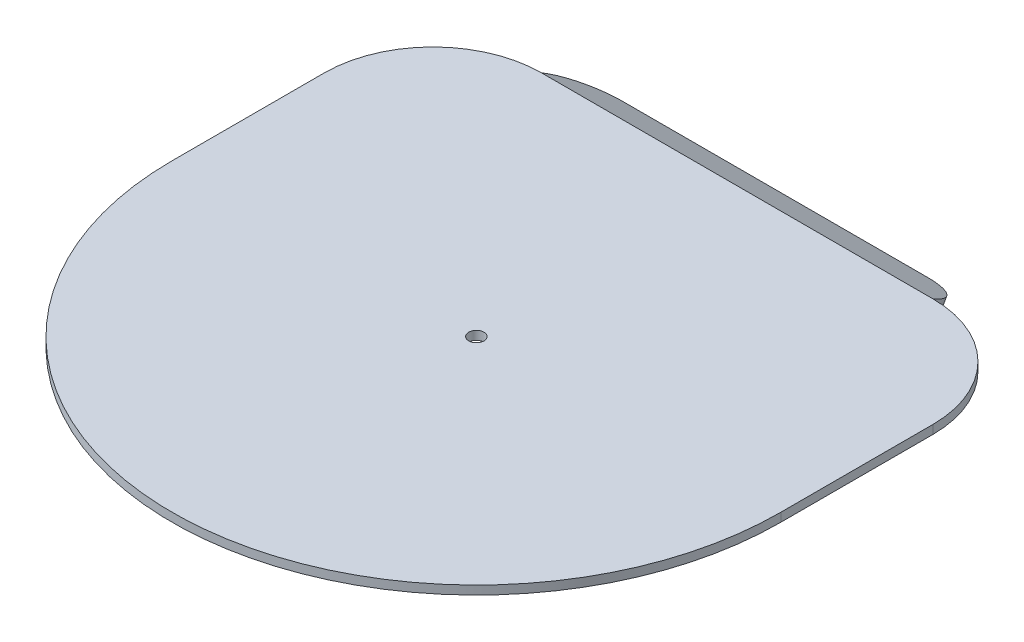
from build123d import *

# Parameters (mm, degrees)
BOSS_EXTRUDE1_DEPTH      = 2
BOSS_EXTRUDE2_DEPTH      = 45
BOSS_EXTRUDE2_DEPTH_BACK = 45
FILLET1_R                = 10
SKETCH4_R                = 1.75
CUT_EXTRUDE2_DEPTH       = 10
SKETCH5_R                = 37
SKETCH5_R_2              = 35
BOSS_EXTRUDE3_DEPTH      = 5
SKETCH6_R                = 43
SKETCH6_R_2              = 41
BOSS_EXTRUDE4_DEPTH      = 5
SKETCH7_W                = 8
SKETCH7_H                = 7.537403722
BOSS_EXTRUDE5_DEPTH      = 5
SKETCH8_R                = 2
CUT_EXTRUDE3_DEPTH       = 25
CIRPATTERN1_COUNT        = 8


with BuildPart() as part:
    # Sketch1 → Boss-Extrude1 (new body)
    with BuildSketch(Plane(origin=(0, 0, 0), x_dir=(1, 0, 0), z_dir=(0, 1, 0))):
        with BuildLine():
            Line((-70, 0), (-70, 35))
            ThreePointArc((-70, 35), (-62.67766953, 52.67766953), (-45, 60))
            Line((-45, 60), (45, 60))
            ThreePointArc((45, 60), (62.67766953, 52.67766953), (70, 35))
            Line((70, 35), (70, 0))
            ThreePointArc((70, 0), (0, -70), (-70, 0))
        make_face()
    extrude(amount=BOSS_EXTRUDE1_DEPTH)

    # Sketch3 → Boss-Extrude2 (add, two sides: drawn at the far end of the back side and taken through both)
    with BuildSketch(Plane(origin=(0, 0, 0), x_dir=(0, 0, -1), z_dir=(1, 0, 0)).offset(-BOSS_EXTRUDE2_DEPTH_BACK)):
        Polygon((60, 2), (58.845299462, 0), (67.505553499, -5), (68.660254038, -3), align=None)
    extrude(amount=BOSS_EXTRUDE2_DEPTH + BOSS_EXTRUDE2_DEPTH_BACK)

    # Fillet1
    # the kernel refuses this fillet: 10 mm, written as the material it takes off along each edge
    with BuildSketch(Plane(origin=(-45, -26.650635095, -55.005553499), x_dir=(0, 0.4999999999999941, 0.866025403784442), z_dir=(0, 0.866025403784442, -0.49999999999999417))) as fillet1_piece_1_section:
        with BuildLine():
            CenterArc((FILLET1_R, FILLET1_R), FILLET1_R, 180, 90)
            Line((0, FILLET1_R), (0, 0))
            Line((0, 0), (FILLET1_R, 0))
        make_face()
    fillet1_piece_1 = extrude(amount=52.309401077, mode=Mode.PRIVATE)
    fillet1_piece_1 = fillet1_piece_1 & Plane(origin=(-45, -18.824797401, -35), x_dir=(-1, 0, 0), z_dir=(0, -1, 0)) * Cylinder(25, 145, mode=Mode.PRIVATE)
    fillet1_piece_1 = split(fillet1_piece_1, bisect_by=Plane(origin=(-43.184486193, 0, -56.170911552), z_dir=(0, -1, 0)), keep=Keep.TOP, mode=Mode.PRIVATE)
    add(fillet1_piece_1, mode=Mode.SUBTRACT)
    with BuildSketch(Plane(origin=(-45, -26.650635095, -55.005553499), x_dir=(0, 0.4999999999999941, 0.866025403784442), z_dir=(0, 0.866025403784442, -0.49999999999999417))) as fillet1_piece_2_section:
        with BuildLine():
            CenterArc((FILLET1_R, FILLET1_R), FILLET1_R, 180, 90)
            Line((0, FILLET1_R), (0, 0))
            Line((0, 0), (FILLET1_R, 0))
        make_face()
    fillet1_piece_2 = extrude(amount=52.309401077, mode=Mode.PRIVATE)
    fillet1_piece_2 = fillet1_piece_2 - Plane(origin=(-45, -7.670115749, -35), x_dir=(-1, 0, 0), z_dir=(0, -1, 0)) * Cylinder(25, 145, mode=Mode.PRIVATE)
    fillet1_piece_2 = split(fillet1_piece_2, bisect_by=Plane(origin=(-42.257371848, 0, -64.168812887), z_dir=(0, -1, 0)), keep=Keep.TOP, mode=Mode.PRIVATE)
    add(fillet1_piece_2, mode=Mode.SUBTRACT)
    with BuildSketch(Plane(origin=(-45, -26.650635095, -55.005553499), x_dir=(0, 0.4999999999999941, 0.866025403784442), z_dir=(0, 0.866025403784442, -0.49999999999999417))) as fillet1_piece_3_section:
        with BuildLine():
            CenterArc((FILLET1_R, FILLET1_R), FILLET1_R, 180, 90)
            Line((0, FILLET1_R), (0, 0))
            Line((0, 0), (FILLET1_R, 0))
        make_face()
    fillet1_piece_3 = extrude(amount=52.309401077, mode=Mode.PRIVATE)
    fillet1_piece_3 = fillet1_piece_3 - Plane(origin=(-45, 9.924498684, -35), x_dir=(-1, 0, 0), z_dir=(0, -1, 0)) * Cylinder(25, 145, mode=Mode.PRIVATE)
    fillet1_piece_3 = split(fillet1_piece_3, bisect_by=Plane(origin=(-42.804499142, 0, -73.375859485), z_dir=(0, 1, 0)), keep=Keep.TOP, mode=Mode.PRIVATE)
    add(fillet1_piece_3, mode=Mode.SUBTRACT)
    with BuildSketch(Plane(origin=(45, -26.650635095, -55.005553499), x_dir=(0, 0.4999999999999941, 0.866025403784442), z_dir=(0, 0.866025403784442, -0.49999999999999417))) as fillet1_piece_4_section:
        with BuildLine():
            CenterArc((FILLET1_R, -FILLET1_R), FILLET1_R, 90, 90)
            Line((0, -FILLET1_R), (0, 0))
            Line((0, 0), (FILLET1_R, 0))
        make_face()
    fillet1_piece_4 = extrude(amount=52.309401077, mode=Mode.PRIVATE)
    fillet1_piece_4 = split(fillet1_piece_4, bisect_by=Plane(origin=(43.184486323, 0, -56.170910661), z_dir=(0, -1, 0)), keep=Keep.TOP, mode=Mode.PRIVATE)
    fillet1_piece_4 = fillet1_piece_4 & Plane(origin=(45, -18.824795148, -35), x_dir=(0, 0, -1), z_dir=(0, -1, 0)) * Cylinder(25, 145, mode=Mode.PRIVATE)
    add(fillet1_piece_4, mode=Mode.SUBTRACT)
    with BuildSketch(Plane(origin=(45, -26.650635095, -55.005553499), x_dir=(0, 0.4999999999999941, 0.866025403784442), z_dir=(0, 0.866025403784442, -0.49999999999999417))) as fillet1_piece_5_section:
        with BuildLine():
            CenterArc((FILLET1_R, -FILLET1_R), FILLET1_R, 90, 90)
            Line((0, -FILLET1_R), (0, 0))
            Line((0, 0), (FILLET1_R, 0))
        make_face()
    fillet1_piece_5 = extrude(amount=52.309401077, mode=Mode.PRIVATE)
    fillet1_piece_5 = split(fillet1_piece_5, bisect_by=Plane(origin=(42.257371964, 0, -64.168814944), z_dir=(0, -1, 0)), keep=Keep.TOP, mode=Mode.PRIVATE)
    fillet1_piece_5 = fillet1_piece_5 - Plane(origin=(45, -7.670111448, -35), x_dir=(0, 0, -1), z_dir=(0, -1, 0)) * Cylinder(25, 145, mode=Mode.PRIVATE)
    add(fillet1_piece_5, mode=Mode.SUBTRACT)
    with BuildSketch(Plane(origin=(45, -26.650635095, -55.005553499), x_dir=(0, 0.4999999999999941, 0.866025403784442), z_dir=(0, 0.866025403784442, -0.49999999999999417))) as fillet1_piece_6_section:
        with BuildLine():
            CenterArc((FILLET1_R, -FILLET1_R), FILLET1_R, 90, 90)
            Line((0, -FILLET1_R), (0, 0))
            Line((0, 0), (FILLET1_R, 0))
        make_face()
    fillet1_piece_6 = extrude(amount=52.309401077, mode=Mode.PRIVATE)
    fillet1_piece_6 = split(fillet1_piece_6, bisect_by=Plane(origin=(42.804499142, 0, -73.375859482), z_dir=(0, 1, 0)), keep=Keep.TOP, mode=Mode.PRIVATE)
    fillet1_piece_6 = fillet1_piece_6 - Plane(origin=(45, 9.924498682, -35), x_dir=(0, 0, -1), z_dir=(0, -1, 0)) * Cylinder(25, 145, mode=Mode.PRIVATE)
    add(fillet1_piece_6, mode=Mode.SUBTRACT)

    # Sketch4 → Cut-Extrude2 (cut)
    with BuildSketch(Plane(origin=(0, 2, 0), x_dir=(1, 0, 0), z_dir=(0, 1, 0))):
        with Locations(Location((0, 0, 0), (0, 0, 270))):
            Circle(SKETCH4_R)
    extrude(amount=-CUT_EXTRUDE2_DEPTH, mode=Mode.SUBTRACT)

    # Sketch5 → Boss-Extrude3 (add)
    with BuildSketch(Plane.XZ):
        with Locations(Location((0, 0, 0), (0, 0, 270))):
            Circle(SKETCH5_R)
        with Locations(Location((0, 0, 0), (0, 0, 270))):
            Circle(SKETCH5_R_2, mode=Mode.SUBTRACT)
    extrude(amount=BOSS_EXTRUDE3_DEPTH)

    # Sketch6 → Boss-Extrude4 (add)
    with BuildSketch(Plane.XZ):
        with Locations(Location((0, 0, 0), (0, 0, 270))):
            Circle(SKETCH6_R)
        with Locations(Location((0, 0, 0), (0, 0, 270))):
            Circle(SKETCH6_R_2, mode=Mode.SUBTRACT)
    extrude(amount=BOSS_EXTRUDE4_DEPTH)

    # Sketch7 → Boss-Extrude5 (add)
    with BuildSketch(Plane.XZ):
        with Locations((0, -45.410784345)):
            Rectangle(SKETCH7_W, SKETCH7_H)
    boss_extrude5 = extrude(amount=BOSS_EXTRUDE5_DEPTH)

    # Sketch8 → Cut-Extrude3 (cut)
    with BuildSketch(Plane(origin=(0, 0, -49.179486206), x_dir=(-1, 0, 0), z_dir=(0, 0, -1))):
        with Locations((0, -2.5)):
            Circle(SKETCH8_R)
    cut_extrude3 = extrude(amount=-CUT_EXTRUDE3_DEPTH, mode=Mode.SUBTRACT)

    # CirPattern1: Boss-Extrude5, Cut-Extrude3 ×8 about axis
    cirpattern1_axis = Axis((0, 0, 0), (0, 1, 0))
    add([boss_extrude5.rotate(cirpattern1_axis, i * 360 / CIRPATTERN1_COUNT) for i in range(1, CIRPATTERN1_COUNT)])
    add([cut_extrude3.rotate(cirpattern1_axis, i * 360 / CIRPATTERN1_COUNT) for i in range(1, CIRPATTERN1_COUNT)], mode=Mode.SUBTRACT)


solid = part.part
